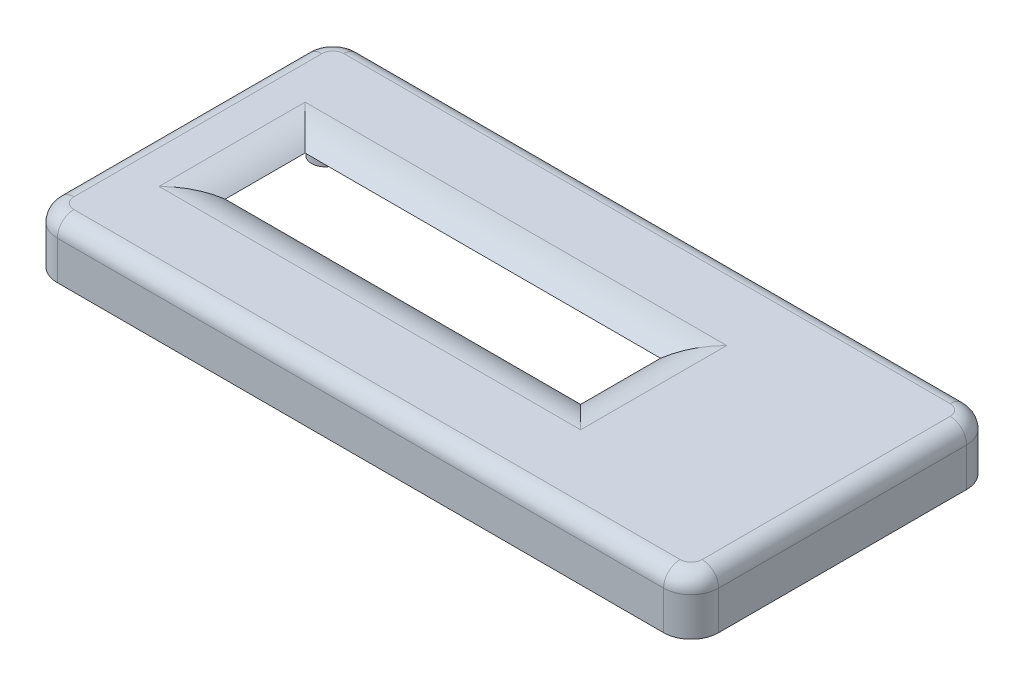
from build123d import *

# Parameters (mm, degrees)
BOSS_EXTRUDE1_DEPTH     = 10
SHELL1_T                = -2
SKETCH4_W               = 64.5
SKETCH4_H               = 14.5
CUT_EXTRUDE1_DEPTH      = 67.755149614
FILLET1_R               = 10
CHAMFER3_SIZE           = 2
CUT_EXTRUDE2_DEPTH      = 67.484960705
CUT_EXTRUDE2_DEPTH_BACK = 1
SKETCH6_R               = 15.5
SKETCH7_R               = 2.5
SKETCH7_R_2             = 1.05
BOSS_EXTRUDE2_DEPTH     = 7.5
CHAMFER2_SIZE           = 1
FILLET2_R               = 3
BOSS_EXTRUDE3_REACH     = 68.755
SKETCH10_R              = 4.5
SKETCH10_R_2            = 1.75
FILLET3_R               = 2


with BuildPart() as part:
    # Sketch1 → Boss-Extrude1 (new body)
    with BuildSketch(Plane(origin=(0, 0, 0), x_dir=(1, 0, 0), z_dir=(0, 1, 0))):
        with BuildLine():
            Line((60, -22.5), (60, 22.5))
            ThreePointArc((60, 22.5), (58.535533906, 26.035533906), (55, 27.5))
            Line((55, 27.5), (-55, 27.5))
            ThreePointArc((-55, 27.5), (-58.535533906, 26.035533906), (-60, 22.5))
            Line((-60, 22.5), (-60, -22.5))
            ThreePointArc((-60, -22.5), (-58.535533906, -26.035533906), (-55, -27.5))
            Line((-55, -27.5), (55, -27.5))
            ThreePointArc((55, -27.5), (58.535533906, -26.035533906), (60, -22.5))
        make_face()
    extrude(amount=BOSS_EXTRUDE1_DEPTH)

    # Shell1
    shell1_openings = [part.faces().sort_by_distance(p)[0] for p in [
        (0, 0, 0),
    ]]
    offset(amount=SHELL1_T, openings=shell1_openings, kind=Kind.INTERSECTION)

    # Sketch4 → Cut-Extrude1 (cut, through all)
    with BuildSketch(Plane(origin=(0, 10, 0), x_dir=(1, 0, 0), z_dir=(0, 1, 0))):
        with Locations((-12.651345503, 0.10818522)):
            Rectangle(SKETCH4_W, SKETCH4_H)
    extrude(amount=-CUT_EXTRUDE1_DEPTH, mode=Mode.SUBTRACT)

    # Fillet1
    # the kernel refuses this fillet: 10 mm, written as the material it takes off along each edge
    with BuildSketch(Plane(origin=(19.598654497, 10, 7.14181478), x_dir=(1, 0, 0), z_dir=(0, 0, -1)), Plane(origin=(-44.901345503, 10, -7.35818522), x_dir=(-1, 0, 0), z_dir=(0, 0, 1))) as fillet1_piece_1:
        with BuildLine():
            CenterArc((6, 10), FILLET1_R, 233.130102354, 36.869897646)
            Line((0, 2), (-0.12, 1.84))
            ThreePointArc((-0.12, 1.84), (-0.2, 1), (-0.2, 0))
            Line((-0.2, 0), (0, -0.2))
            Line((0, -0.2), (6, -0.2))
            Line((6, -0.2), (6, 0))
        make_face()
    extrude(amount=14.5, mode=Mode.SUBTRACT)
    with BuildSketch(Plane(origin=(-44.901345503, 10, 7.14181478), x_dir=(0, 0, 1), z_dir=(1, 0, 0)), Plane(origin=(19.598654497, 10, -7.35818522), x_dir=(0, 0, -1), z_dir=(-1, 0, 0))) as fillet1_piece_2:
        with BuildLine():
            CenterArc((6, 10), FILLET1_R, 233.130102354, 36.869897646)
            Line((0, 2), (-0.12, 1.84))
            ThreePointArc((-0.12, 1.84), (-0.2, 1), (-0.2, 0))
            Line((-0.2, 0), (0, -0.2))
            Line((0, -0.2), (6, -0.2))
            Line((6, -0.2), (6, 0))
        make_face()
    extrude(amount=64.5, mode=Mode.SUBTRACT)
    with BuildSketch(Plane(origin=(-44.901345503, 10, 7.14181478), x_dir=(0, 0, 1), z_dir=(1, 0, 0))) as fillet1_piece_3a_section:
        with BuildLine():
            CenterArc((6, 10), FILLET1_R, 233.130102354, 36.869897646)
            Line((0, 2), (-0.12, 1.84))
            ThreePointArc((-0.12, 1.84), (-0.2, 1), (-0.2, 0))
            Line((-0.2, 0), (0, -0.2))
            Line((0, -0.2), (6, -0.2))
            Line((6, -0.2), (6, 0))
        make_face()
    fillet1_piece_3a = extrude(amount=79.5, mode=Mode.PRIVATE)
    fillet1_piece_3a = split(fillet1_piece_3a, bisect_by=Plane(origin=(19.598654497, 9.547623205, 8.841160407), z_dir=(1, 0, 0)), keep=Keep.TOP, mode=Mode.PRIVATE)
    with BuildSketch(Plane(origin=(19.598654497, 10, 22.14181478), x_dir=(1, 0, 0), z_dir=(0, 0, -1))) as fillet1_piece_3b_section:
        with BuildLine():
            CenterArc((6, 10), FILLET1_R, 233.130102354, 36.869897646)
            Line((0, 2), (-0.12, 1.84))
            ThreePointArc((-0.12, 1.84), (-0.2, 1), (-0.2, 0))
            Line((-0.2, 0), (0, -0.2))
            Line((0, -0.2), (6, -0.2))
            Line((6, -0.2), (6, 0))
        make_face()
    fillet1_piece_3b = extrude(amount=29.5, mode=Mode.PRIVATE)
    fillet1_piece_3b = split(fillet1_piece_3b, bisect_by=Plane(origin=(21.298000124, 9.547623205, 7.14181478), z_dir=(0, 0, 1)), keep=Keep.TOP, mode=Mode.PRIVATE)
    fillet1_piece_3 = fillet1_piece_3a & fillet1_piece_3b
    add(fillet1_piece_3, mode=Mode.SUBTRACT)
    with BuildSketch(Plane(origin=(19.598654497, 10, 7.14181478), x_dir=(1, 0, 0), z_dir=(0, 0, -1))) as fillet1_piece_4a_section:
        with BuildLine():
            CenterArc((6, 10), FILLET1_R, 233.130102354, 36.869897646)
            Line((0, 2), (-0.12, 1.84))
            ThreePointArc((-0.12, 1.84), (-0.2, 1), (-0.2, 0))
            Line((-0.2, 0), (0, -0.2))
            Line((0, -0.2), (6, -0.2))
            Line((6, -0.2), (6, 0))
        make_face()
    fillet1_piece_4a = extrude(amount=29.5, mode=Mode.PRIVATE)
    fillet1_piece_4a = split(fillet1_piece_4a, bisect_by=Plane(origin=(21.298000124, 9.547623205, -7.35818522), z_dir=(0, 0, -1)), keep=Keep.TOP, mode=Mode.PRIVATE)
    with BuildSketch(Plane(origin=(34.598654497, 10, -7.35818522), x_dir=(0, 0, -1), z_dir=(-1, 0, 0))) as fillet1_piece_4b_section:
        with BuildLine():
            CenterArc((6, 10), FILLET1_R, 233.130102354, 36.869897646)
            Line((0, 2), (-0.12, 1.84))
            ThreePointArc((-0.12, 1.84), (-0.2, 1), (-0.2, 0))
            Line((-0.2, 0), (0, -0.2))
            Line((0, -0.2), (6, -0.2))
            Line((6, -0.2), (6, 0))
        make_face()
    fillet1_piece_4b = extrude(amount=79.5, mode=Mode.PRIVATE)
    fillet1_piece_4b = split(fillet1_piece_4b, bisect_by=Plane(origin=(19.598654497, 9.547623205, -9.057530847), z_dir=(1, 0, 0)), keep=Keep.TOP, mode=Mode.PRIVATE)
    fillet1_piece_4 = fillet1_piece_4a & fillet1_piece_4b
    add(fillet1_piece_4, mode=Mode.SUBTRACT)
    with BuildSketch(Plane(origin=(-44.901345503, 10, -7.35818522), x_dir=(-1, 0, 0), z_dir=(0, 0, 1))) as fillet1_piece_5a_section:
        with BuildLine():
            CenterArc((6, 10), FILLET1_R, 233.130102354, 36.869897646)
            Line((0, 2), (-0.12, 1.84))
            ThreePointArc((-0.12, 1.84), (-0.2, 1), (-0.2, 0))
            Line((-0.2, 0), (0, -0.2))
            Line((0, -0.2), (6, -0.2))
            Line((6, -0.2), (6, 0))
        make_face()
    fillet1_piece_5a = extrude(amount=29.5, mode=Mode.PRIVATE)
    fillet1_piece_5a = split(fillet1_piece_5a, bisect_by=Plane(origin=(-46.60069113, 9.547623205, 7.14181478), z_dir=(0, 0, 1)), keep=Keep.TOP, mode=Mode.PRIVATE)
    with BuildSketch(Plane(origin=(-59.901345503, 10, 7.14181478), x_dir=(0, 0, 1), z_dir=(1, 0, 0))) as fillet1_piece_5b_section:
        with BuildLine():
            CenterArc((6, 10), FILLET1_R, 233.130102354, 36.869897646)
            Line((0, 2), (-0.12, 1.84))
            ThreePointArc((-0.12, 1.84), (-0.2, 1), (-0.2, 0))
            Line((-0.2, 0), (0, -0.2))
            Line((0, -0.2), (6, -0.2))
            Line((6, -0.2), (6, 0))
        make_face()
    fillet1_piece_5b = extrude(amount=79.5, mode=Mode.PRIVATE)
    fillet1_piece_5b = split(fillet1_piece_5b, bisect_by=Plane(origin=(-44.901345503, 9.547623205, 8.841160407), z_dir=(-1, 0, 0)), keep=Keep.TOP, mode=Mode.PRIVATE)
    fillet1_piece_5 = fillet1_piece_5a & fillet1_piece_5b
    add(fillet1_piece_5, mode=Mode.SUBTRACT)
    with BuildSketch(Plane(origin=(-44.901345503, 10, -22.35818522), x_dir=(-1, 0, 0), z_dir=(0, 0, 1))) as fillet1_piece_6a_section:
        with BuildLine():
            CenterArc((6, 10), FILLET1_R, 233.130102354, 36.869897646)
            Line((0, 2), (-0.12, 1.84))
            ThreePointArc((-0.12, 1.84), (-0.2, 1), (-0.2, 0))
            Line((-0.2, 0), (0, -0.2))
            Line((0, -0.2), (6, -0.2))
            Line((6, -0.2), (6, 0))
        make_face()
    fillet1_piece_6a = extrude(amount=29.5, mode=Mode.PRIVATE)
    fillet1_piece_6a = split(fillet1_piece_6a, bisect_by=Plane(origin=(-46.60069113, 9.547623205, -7.35818522), z_dir=(0, 0, -1)), keep=Keep.TOP, mode=Mode.PRIVATE)
    with BuildSketch(Plane(origin=(19.598654497, 10, -7.35818522), x_dir=(0, 0, -1), z_dir=(-1, 0, 0))) as fillet1_piece_6b_section:
        with BuildLine():
            CenterArc((6, 10), FILLET1_R, 233.130102354, 36.869897646)
            Line((0, 2), (-0.12, 1.84))
            ThreePointArc((-0.12, 1.84), (-0.2, 1), (-0.2, 0))
            Line((-0.2, 0), (0, -0.2))
            Line((0, -0.2), (6, -0.2))
            Line((6, -0.2), (6, 0))
        make_face()
    fillet1_piece_6b = extrude(amount=79.5, mode=Mode.PRIVATE)
    fillet1_piece_6b = split(fillet1_piece_6b, bisect_by=Plane(origin=(-44.901345503, 9.547623205, -9.057530847), z_dir=(-1, 0, 0)), keep=Keep.TOP, mode=Mode.PRIVATE)
    fillet1_piece_6 = fillet1_piece_6a & fillet1_piece_6b
    add(fillet1_piece_6, mode=Mode.SUBTRACT)

    # Chamfer3
    chamfer3_edges = [part.edges().sort_by_distance(p)[0] for p in [
        (57.121320344, 8, 24.621320344),
        (58, 8, 0),
        (57.121320344, 8, -24.621320344),
        (0, 8, -25.5),
        (-57.121320344, 8, -24.621320344),
        (-58, 8, 0),
        (-57.121320344, 8, 24.621320344),
        (0, 8, 25.5),
    ]]
    chamfer(chamfer3_edges, length=CHAMFER3_SIZE)

    # Sketch6 → Cut-Extrude2 (cut, two sides: drawn at the far end of the back side and taken through both)
    with BuildSketch(Plane.XZ.offset(-8).offset(-CUT_EXTRUDE2_DEPTH_BACK)):
        with Locations(Location((39.589038041, -0.101474043, 0), (0, 0, 90))):
            Circle(SKETCH6_R)
    extrude(amount=CUT_EXTRUDE2_DEPTH + CUT_EXTRUDE2_DEPTH_BACK, mode=Mode.SUBTRACT)

    # Sketch7 → Boss-Extrude2 (add)
    # profile 1 of 4: a face of its own
    with BuildSketch(Plane.XZ.offset(-8)):
        with Locations(Location((24.848654497, 14.86681478, 0), (0, 0, 90))):
            Circle(SKETCH7_R)
        with Locations(Location((24.848654497, 14.86681478, 0), (0, 0, 90))):
            Circle(SKETCH7_R_2, mode=Mode.SUBTRACT)
    # profile 2 of 4: a face of its own
    with BuildSketch(Plane.XZ.offset(-8)):
        with Locations(Location((24.848654497, -16.28318522, 0), (0, 0, 90))):
            Circle(SKETCH7_R)
        with Locations(Location((24.848654497, -16.28318522, 0), (0, 0, 90))):
            Circle(SKETCH7_R_2, mode=Mode.SUBTRACT)
    # profile 3 of 4: a face of its own
    with BuildSketch(Plane.XZ.offset(-8)):
        with Locations(Location((-50.151345503, 14.86681478, 0), (0, 0, 90))):
            Circle(SKETCH7_R)
        with Locations(Location((-50.151345503, 14.86681478, 0), (0, 0, 90))):
            Circle(SKETCH7_R_2, mode=Mode.SUBTRACT)
    # profile 4 of 4: a face of its own
    with BuildSketch(Plane.XZ.offset(-8)):
        with Locations(Location((-50.151345503, -16.28318522, 0), (0, 0, 90))):
            Circle(SKETCH7_R)
        with Locations(Location((-50.151345503, -16.28318522, 0), (0, 0, 90))):
            Circle(SKETCH7_R_2, mode=Mode.SUBTRACT)
    extrude(amount=BOSS_EXTRUDE2_DEPTH)

    # Chamfer2
    chamfer2_edges = [part.edges().sort_by_distance(p)[0] for p in [
        (24.848654497, 8, 12.36681478),
        (24.848654497, 8, -18.78318522),
        (-50.151345503, 8, 12.36681478),
        (-50.151345503, 8, -18.78318522),
    ]]
    chamfer(chamfer2_edges, length=CHAMFER2_SIZE)

    # Fillet2
    fillet2_edges = [part.edges().sort_by_distance(p)[0] for p in [
        (58.535533906, 10, -26.035533906),
        (0, 10, -27.5),
        (-58.535533906, 10, -26.035533906),
        (-60, 10, 0),
        (-58.535533906, 10, 26.035533906),
        (0, 10, 27.5),
        (58.535533906, 10, 26.035533906),
        (60, 10, 0),
    ]]
    fillet(fillet2_edges, radius=FILLET2_R)

    # Sketch10 → Boss-Extrude3 (add, up to next)
    with BuildSketch(Plane.XZ, mode=Mode.PRIVATE) as boss_extrude3_sk1:
        with Locations((-55, 22.5)):
            Circle(SKETCH10_R)
        with Locations(Location((-55, 22.5, 0), (0, 0, 270))):
            Circle(SKETCH10_R_2, mode=Mode.SUBTRACT)
    boss_extrude3_tool1 = extrude(boss_extrude3_sk1.sketch, amount=-BOSS_EXTRUDE3_REACH, mode=Mode.PRIVATE) - part.part
    # Sketch10 → Boss-Extrude3 (add, up to next)
    with BuildSketch(Plane.XZ, mode=Mode.PRIVATE) as boss_extrude3_sk2:
        with Locations((55, 22.5)):
            Circle(SKETCH10_R)
        with Locations(Location((55, 22.5, 0), (0, 0, 270))):
            Circle(SKETCH10_R_2, mode=Mode.SUBTRACT)
    boss_extrude3_tool2 = extrude(boss_extrude3_sk2.sketch, amount=-BOSS_EXTRUDE3_REACH, mode=Mode.PRIVATE) - part.part
    # Sketch10 → Boss-Extrude3 (add, up to next)
    with BuildSketch(Plane.XZ, mode=Mode.PRIVATE) as boss_extrude3_sk3:
        with Locations((55, -22.5)):
            Circle(SKETCH10_R)
        with Locations(Location((55, -22.5, 0), (0, 0, 270))):
            Circle(SKETCH10_R_2, mode=Mode.SUBTRACT)
    boss_extrude3_tool3 = extrude(boss_extrude3_sk3.sketch, amount=-BOSS_EXTRUDE3_REACH, mode=Mode.PRIVATE) - part.part
    # Sketch10 → Boss-Extrude3 (add, up to next)
    with BuildSketch(Plane.XZ, mode=Mode.PRIVATE) as boss_extrude3_sk4:
        with Locations((-55, -22.5)):
            Circle(SKETCH10_R)
        with Locations(Location((-55, -22.5, 0), (0, 0, 270))):
            Circle(SKETCH10_R_2, mode=Mode.SUBTRACT)
    boss_extrude3_tool4 = extrude(boss_extrude3_sk4.sketch, amount=-BOSS_EXTRUDE3_REACH, mode=Mode.PRIVATE) - part.part
    add(boss_extrude3_tool1.solids().sort_by_distance((-59.372721, 0, 22.5))[0])
    add(boss_extrude3_tool2.solids().sort_by_distance((50.627279, 0, 22.5))[0])
    add(boss_extrude3_tool3.solids().sort_by_distance((50.627279, 0, -22.5))[0])
    add(boss_extrude3_tool4.solids().sort_by_distance((-59.372721, 0, -22.5))[0])

    # Fillet3
    # the kernel refuses this fillet: 2 mm, written as the material it adds along each edge
    with BuildSketch(Plane(origin=(55, 8, 22.5), x_dir=(-0.23270158386408799, 0, 0.9725481853703418), z_dir=(0.9725481853703418, 0, 0.23270158386408799))) as fillet3_piece_1_section:
        with BuildLine():
            CenterArc((4.5 + FILLET3_R, FILLET3_R), FILLET3_R, 180, 90)
            Line((4.5, FILLET3_R), (4.5, 0))
            Line((4.5, 0), (4.5 + FILLET3_R, 0))
        make_face()
    fillet3_piece_1 = revolve(axis=Axis((55, 8, 22.5), (0, -1, 0)), revolution_arc=243.087644723, mode=Mode.PRIVATE)
    fillet3_piece_1 = split(fillet3_piece_1, bisect_by=Plane(origin=(50.165162842, 7.482769531, 25.5), z_dir=(0, 0, -1)), keep=Keep.TOP, mode=Mode.PRIVATE)
    fillet3_piece_1 = split(fillet3_piece_1, bisect_by=Plane(origin=(58, 7.482769531, 22.801349384), z_dir=(-1, 0, 0)), keep=Keep.TOP, mode=Mode.PRIVATE)
    add(fillet3_piece_1)
    with BuildSketch(Plane(origin=(55, 8, -22.5), x_dir=(0.9725481853703416, 0, 0.23270158386408873), z_dir=(0.23270158386408873, 0, -0.9725481853703416))) as fillet3_piece_2_section:
        with BuildLine():
            CenterArc((4.5 + FILLET3_R, FILLET3_R), FILLET3_R, 180, 90)
            Line((4.5, FILLET3_R), (4.5, 0))
            Line((4.5, 0), (4.5 + FILLET3_R, 0))
        make_face()
    fillet3_piece_2 = revolve(axis=Axis((55, 8, -22.5), (0, -1, 0)), revolution_arc=243.087644723, mode=Mode.PRIVATE)
    fillet3_piece_2 = split(fillet3_piece_2, bisect_by=Plane(origin=(55.301349384, 7.482769531, -25.5), z_dir=(0, 0, 1)), keep=Keep.TOP, mode=Mode.PRIVATE)
    fillet3_piece_2 = split(fillet3_piece_2, bisect_by=Plane(origin=(58, 7.482769531, -17.665162842), z_dir=(-1, 0, 0)), keep=Keep.TOP, mode=Mode.PRIVATE)
    add(fillet3_piece_2)
    with BuildSketch(Plane(origin=(-55, 8, -22.5), x_dir=(0.23324906635709736, 0, -0.9724170263027805), z_dir=(-0.9724170263027805, 0, -0.23324906635709736))) as fillet3_piece_3_section:
        with BuildLine():
            CenterArc((4.5 + FILLET3_R, FILLET3_R), FILLET3_R, 180, 90)
            Line((4.5, FILLET3_R), (4.5, 0))
            Line((4.5, 0), (4.5 + FILLET3_R, 0))
        make_face()
    fillet3_piece_3 = revolve(axis=Axis((-55, 8, -22.5), (0, -1, 0)), revolution_arc=183.629785906, mode=Mode.PRIVATE)
    fillet3_piece_3 = split(fillet3_piece_3, bisect_by=Plane(origin=(-50.165162842, 7.482769531, -25.5), z_dir=(0, 0, 1)), keep=Keep.TOP, mode=Mode.PRIVATE)
    add(fillet3_piece_3)
    with BuildSketch(Plane(origin=(-55, 8, -22.5), x_dir=(0.9986139483299978, 0, -0.05263252037260303), z_dir=(-0.05263252037260303, 0, -0.9986139483299978))) as fillet3_piece_4_section:
        with BuildLine():
            CenterArc((4.5 + FILLET3_R, FILLET3_R), FILLET3_R, 180, 90)
            Line((4.5, FILLET3_R), (4.5, 0))
            Line((4.5, 0), (4.5 + FILLET3_R, 0))
        make_face()
    fillet3_piece_4 = revolve(axis=Axis((-55, 8, -22.5), (0, -1, 0)), revolution_arc=169.524199322, mode=Mode.PRIVATE)
    fillet3_piece_4 = split(fillet3_piece_4, bisect_by=Plane(origin=(-58, 7.426076181, -19.250067574), z_dir=(1, 0, 0)), keep=Keep.TOP, mode=Mode.PRIVATE)
    add(fillet3_piece_4)
    with BuildSketch(Plane(origin=(-55, 8, 22.5), x_dir=(-0.9725481853703422, 0, -0.2327015838640865), z_dir=(-0.2327015838640865, 0, 0.9725481853703422))) as fillet3_piece_5_section:
        with BuildLine():
            CenterArc((4.5 + FILLET3_R, FILLET3_R), FILLET3_R, 180, 90)
            Line((4.5, FILLET3_R), (4.5, 0))
            Line((4.5, 0), (4.5 + FILLET3_R, 0))
        make_face()
    fillet3_piece_5 = revolve(axis=Axis((-55, 8, 22.5), (0, -1, 0)), revolution_arc=243.087644723, mode=Mode.PRIVATE)
    fillet3_piece_5 = split(fillet3_piece_5, bisect_by=Plane(origin=(-55.301349384, 7.482769531, 25.5), z_dir=(0, 0, -1)), keep=Keep.TOP, mode=Mode.PRIVATE)
    fillet3_piece_5 = split(fillet3_piece_5, bisect_by=Plane(origin=(-58, 7.482769531, 17.665162842), z_dir=(1, 0, 0)), keep=Keep.TOP, mode=Mode.PRIVATE)
    add(fillet3_piece_5)


solid = part.part
